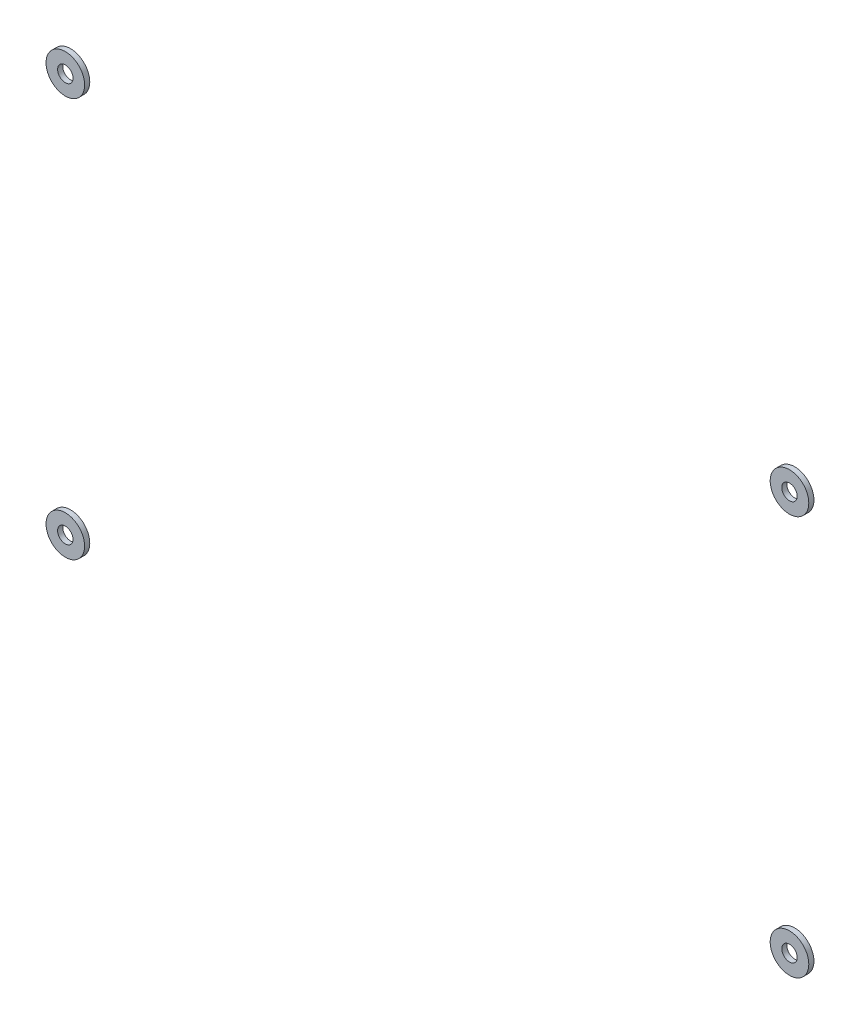
from build123d import *

# Parameters (mm, degrees)
BOSS_EXTRUDE1_START = 70.7
SKETCH1_R           = 3
BOSS_EXTRUDE1_DEPTH = 0.8
BOSS_EXTRUDE2_START = 70.1
SKETCH2_R           = 1.2
BOSS_EXTRUDE2_DEPTH = 3
BOSS_EXTRUDE3_START = 70.7
SKETCH3_R           = 3
BOSS_EXTRUDE3_DEPTH = 0.8
BOSS_EXTRUDE4_START = 70.1
SKETCH4_R           = 1.2
BOSS_EXTRUDE4_DEPTH = 3
BOSS_EXTRUDE5_START = 70.7
SKETCH5_R           = 3
BOSS_EXTRUDE5_DEPTH = 0.8
BOSS_EXTRUDE6_START = 70.1
SKETCH6_R           = 1.2
BOSS_EXTRUDE6_DEPTH = 3
BOSS_EXTRUDE7_START = 70.7
SKETCH7_R           = 3
BOSS_EXTRUDE7_DEPTH = 0.8
BOSS_EXTRUDE8_START = 70.1
SKETCH8_R           = 1.2
BOSS_EXTRUDE8_DEPTH = 3


with BuildPart() as part:
    # Sketch1 → Boss-Extrude1 (new body)
    with BuildSketch(Plane.XY.offset(BOSS_EXTRUDE1_START)):
        with Locations((-56.3, 78.45)):
            Circle(SKETCH1_R)
    extrude(amount=BOSS_EXTRUDE1_DEPTH)


with BuildPart() as body_2:
    # Sketch2 → Boss-Extrude2 (new body)
    with BuildSketch(Plane.XY.offset(BOSS_EXTRUDE2_START)):
        with Locations((-56.3, 78.45)):
            Circle(SKETCH2_R)
    extrude(amount=BOSS_EXTRUDE2_DEPTH)


with BuildPart() as part_1:
    add(part.part)

    # Combine1: cut body 2
    add(body_2.part, mode=Mode.SUBTRACT)


with BuildPart() as body_2_2:
    # Sketch3 → Boss-Extrude3 (new body)
    with BuildSketch(Plane.XY.offset(BOSS_EXTRUDE3_START)):
        with Locations((-56.3, 140.55)):
            Circle(SKETCH3_R)
    extrude(amount=BOSS_EXTRUDE3_DEPTH)


with BuildPart() as body_3:
    # Sketch4 → Boss-Extrude4 (new body)
    with BuildSketch(Plane.XY.offset(BOSS_EXTRUDE4_START)):
        with Locations((-56.3, 140.55)):
            Circle(SKETCH4_R)
    extrude(amount=BOSS_EXTRUDE4_DEPTH)


with BuildPart() as body_2_2_1:
    add(body_2_2.part)

    # Combine2: cut body 3
    add(body_3.part, mode=Mode.SUBTRACT)


with BuildPart() as body_3_2:
    # Sketch5 → Boss-Extrude5 (new body)
    with BuildSketch(Plane.XY.offset(BOSS_EXTRUDE5_START)):
        with Locations((56.3, 78.45)):
            Circle(SKETCH5_R)
    extrude(amount=BOSS_EXTRUDE5_DEPTH)


with BuildPart() as body_4:
    # Sketch6 → Boss-Extrude6 (new body)
    with BuildSketch(Plane.XY.offset(BOSS_EXTRUDE6_START)):
        with Locations((56.3, 78.45)):
            Circle(SKETCH6_R)
    extrude(amount=BOSS_EXTRUDE6_DEPTH)


with BuildPart() as body_3_2_1:
    add(body_3_2.part)

    # Combine3: cut body 4
    add(body_4.part, mode=Mode.SUBTRACT)


with BuildPart() as body_4_2:
    # Sketch7 → Boss-Extrude7 (new body)
    with BuildSketch(Plane.XY.offset(BOSS_EXTRUDE7_START)):
        with Locations((56.3, 140.55)):
            Circle(SKETCH7_R)
    extrude(amount=BOSS_EXTRUDE7_DEPTH)


with BuildPart() as body_5:
    # Sketch8 → Boss-Extrude8 (new body)
    with BuildSketch(Plane.XY.offset(BOSS_EXTRUDE8_START)):
        with Locations((56.3, 140.55)):
            Circle(SKETCH8_R)
    extrude(amount=BOSS_EXTRUDE8_DEPTH)


with BuildPart() as body_4_2_1:
    add(body_4_2.part)

    # Combine4: cut body 5
    add(body_5.part, mode=Mode.SUBTRACT)


solid = Compound([part_1.part, body_2_2_1.part, body_3_2_1.part, body_4_2_1.part])
